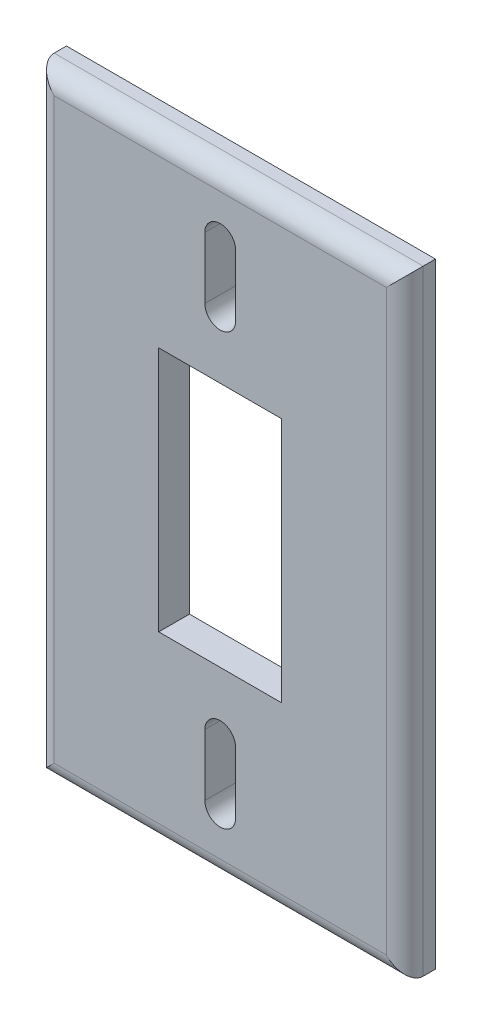
from build123d import *

# Parameters (mm, degrees)
SKETCH1_W          = 60
SKETCH1_H          = 100
SKETCH1_W_2        = 20
SKETCH1_H_2        = 40
EXTRUDE1_DEPTH     = 5
FILLET2_R          = 3
SHELL2_START       = -5
SHELL2_OUTLINE_W   = 55
SHELL2_OUTLINE_H   = 95
SHELL2_OUTLINE_W_2 = 25
SHELL2_OUTLINE_H_2 = 45
SHELL2_DEPTH       = 2.5
SHELL2_START_2     = 2.5
SHELL2_2_DEPTH     = 95
SHELL2_START_3     = 2
SHELL2_3_DEPTH     = 56


with BuildPart() as part:
    # Sketch1 → Extrude1 (new body)
    with BuildSketch(Plane.XY):
        with Locations((30, 50)):
            Rectangle(SKETCH1_W, SKETCH1_H)
        with Locations((30, 50)):
            Rectangle(SKETCH1_W_2, SKETCH1_H_2, mode=Mode.SUBTRACT)
        with BuildLine():
            Line((32.5, 80), (32.5, 90))
            ThreePointArc((32.5, 90), (30, 92.5), (27.5, 90))
            Line((27.5, 90), (27.5, 80))
            ThreePointArc((27.5, 80), (30, 77.5), (32.5, 80))
        make_face(mode=Mode.SUBTRACT)
        with BuildLine():
            Line((27.5, 10), (27.5, 20))
            ThreePointArc((27.5, 20), (30, 22.5), (32.5, 20))
            Line((32.5, 20), (32.5, 10))
            ThreePointArc((32.5, 10), (30, 7.5), (27.5, 10))
        make_face(mode=Mode.SUBTRACT)
    extrude(amount=-EXTRUDE1_DEPTH)

    # Fillet2
    fillet2_edges = [part.edges().sort_by_distance(p)[0] for p in [
        (30, 100, 0),
        (60, 50, 0),
        (30, 0, 0),
        (0, 50, 0),
    ]]
    fillet(fillet2_edges, radius=FILLET2_R)

    # Shell2: read off the stored shape, not the designer's step
    # Shell2 outline → Shell2 (cut)
    with BuildSketch(Plane.XY.offset(SHELL2_START)):
        with Locations((30, 50)):
            Rectangle(SHELL2_OUTLINE_W, SHELL2_OUTLINE_H)
        with BuildLine():
            Line((25, 10), (25, 20))
            ThreePointArc((25, 20), (30, 25), (35, 20))
            Line((35, 20), (35, 10))
            ThreePointArc((35, 10), (30, 5), (25, 10))
        make_face(mode=Mode.SUBTRACT)
        with Locations((30, 50)):
            Rectangle(SHELL2_OUTLINE_W_2, SHELL2_OUTLINE_H_2, mode=Mode.SUBTRACT)
        with BuildLine():
            ThreePointArc((35, 80), (30, 75), (25, 80))
            Line((25, 80), (25, 90))
            ThreePointArc((25, 90), (30, 95), (35, 90))
            Line((35, 90), (35, 80))
        make_face(mode=Mode.SUBTRACT)
    extrude(amount=SHELL2_DEPTH, mode=Mode.SUBTRACT)

    # Shell2 2 outline → Shell2 2 (add)
    with BuildSketch(Plane(origin=(0, 0, 0), x_dir=(1, 0, 0), z_dir=(0, 1, 0)).offset(SHELL2_START_2)):
        with BuildLine():
            Line((57.5, 2.5), (57.5, 3))
            ThreePointArc((57.5, 3), (57.353553391, 2.646446609), (57, 2.5))
            Line((57, 2.5), (57.5, 2.5))
        make_face()
        with BuildLine():
            Line((2.5, 2.5), (3, 2.5))
            ThreePointArc((3, 2.5), (2.646446609, 2.646446609), (2.5, 3))
            Line((2.5, 3), (2.5, 2.5))
        make_face()
    extrude(amount=SHELL2_2_DEPTH)

    # Shell2 3 outline → Shell2 3 (add)
    with BuildSketch(Plane.YZ.offset(SHELL2_START_3)):
        with BuildLine():
            ThreePointArc((2.5, -3), (2.646446609, -2.646446609), (3, -2.5))
            Line((3, -2.5), (2.5, -2.5))
            Line((2.5, -2.5), (2.5, -3))
        make_face()
        with BuildLine():
            ThreePointArc((97, -2.5), (97.353553391, -2.646446609), (97.5, -3))
            Line((97.5, -3), (97.5, -2.5))
            Line((97.5, -2.5), (97, -2.5))
        make_face()
    extrude(amount=SHELL2_3_DEPTH)


solid = part.part
